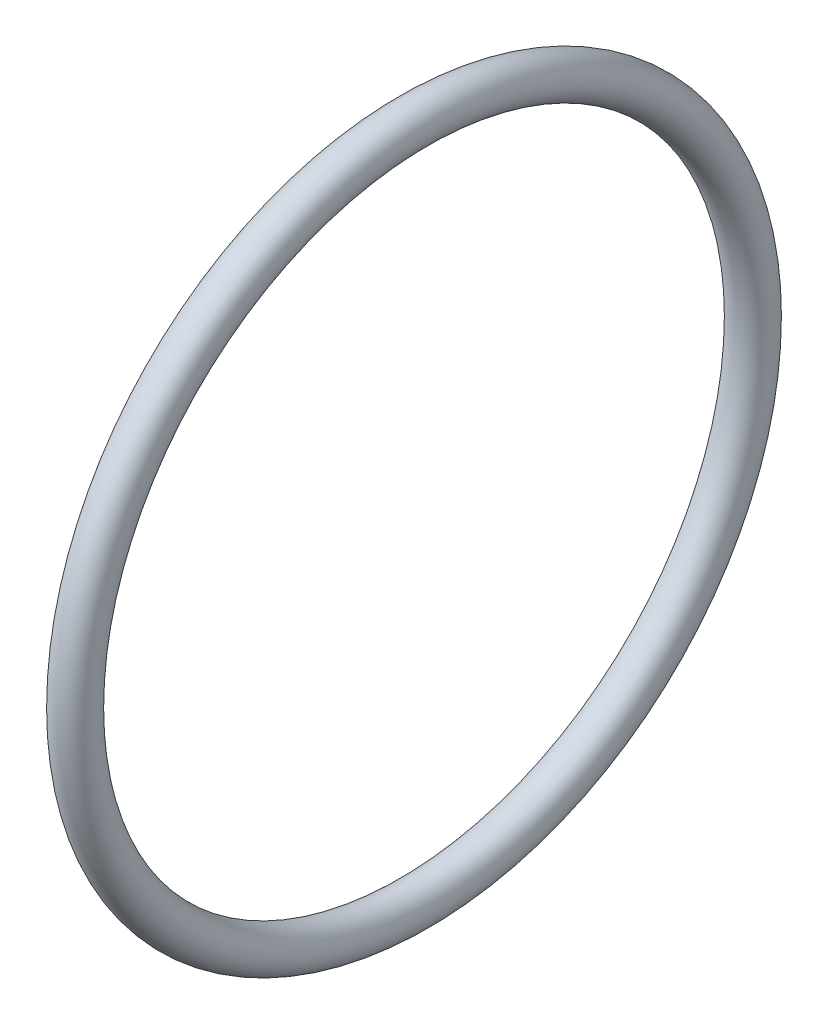
from build123d import *

# Parameters (mm, degrees)
SKETCH3_R = 0.950000005


with BuildPart() as part:
    # Sketch3 → Revolve1 (revolve)
    with BuildSketch(Plane.XY):
        with Locations((21.980400159, 15.949999977)):
            Circle(SKETCH3_R)
    revolve(axis=Axis((0, 0, 0), (1, 0, 0)))


solid = part.part
